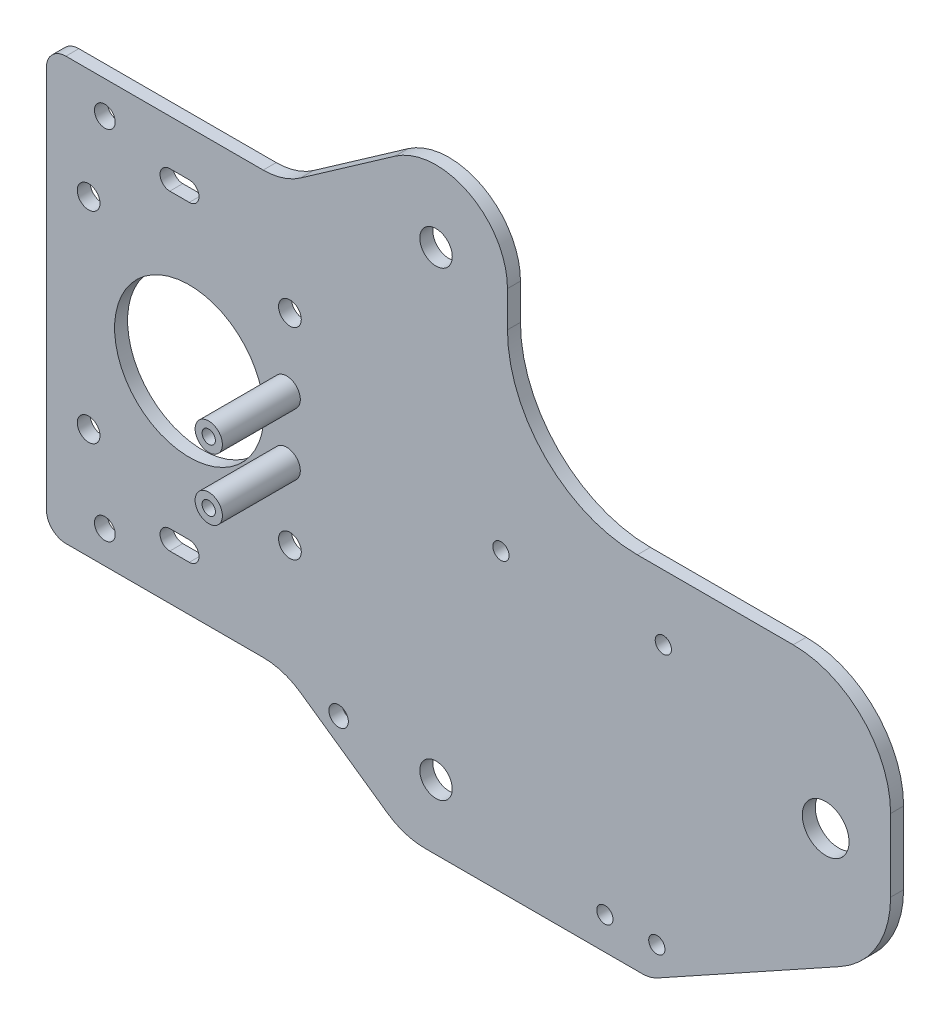
from build123d import *

# Parameters (mm, degrees)
SKETCH_1_R               = 11.5
SKETCH_1_R_2             = 1.75
SKETCH_1_R_3             = 2.5
SKETCH_1_R_4             = 3.6
SM_BASE_FLANGE_1_DEPTH   = 2
SKETCH_4_R               = 3.25
EXTRUDE_1_DEPTH          = 2
HOLE_WIZARD_M3_2_D       = 2.5
CUT_EXTRUDE_1_REACH      = 86.132
SKETCH_8_R               = 2.1
EXTRUDE_2_DEPTH          = 12
HOLE_WIZARD_M2_5_1_D     = 2.05
HOLE_WIZARD_M2_5_1_DEPTH = 10
CUT_EXTRUDE_2_REACH      = 86.89
SKETCH_11_R              = 1.6
SKETCH_12_R              = 3.25
EXTRUDE_3_DEPTH          = 2
HOLE_WIZARD_M3_3_D       = 2.5
CUT_EXTRUDE_3_REACH      = 87.195
SKETCH_15_R              = 1.5


# Sheet-metal steps are written as plain solids
with BuildPart() as part:
    # Sketch 1 → 基体-法兰1 (new body)
    with BuildSketch(Plane.XY):
        with BuildLine():
            Line((-1.743446796, -45.5), (31.707432394, -45.5))
            ThreePointArc((31.707432394, -45.5), (32.958860234, -45.340860292), (34.130627329, -44.873571345))
            Line((34.130627329, -44.873571345), (62.269584803, -29.283067879))
            ThreePointArc((62.269584803, -29.283067879), (67.923694751, -23.776689927), (70, -16.162353844))
            Line((70, -16.162353844), (70, -5))
            ThreePointArc((70, -5), (65.606601718, 5.606601718), (55, 10))
            Line((55, 10), (31, 10))
            ThreePointArc((31, 10), (16.857864376, 15.857864376), (11, 30))
            Line((11, 30), (11, 35.5))
            ThreePointArc((11, 35.5), (5.079234746, 45.257119165), (-6.3093408, 44.510672487))
            Line((-6.3093408, 44.510672487), (-20.879582297, 34.308479557))
            ThreePointArc((-20.879582297, 34.308479557), (-23.608288666, 32.962830493), (-26.615346661, 32.5))
            Line((-26.615346661, 32.5), (-57, 32.5))
            ThreePointArc((-57, 32.5), (-59.121320344, 31.621320344), (-60, 29.5))
            Line((-60, 29.5), (-60, -29.5))
            ThreePointArc((-60, -29.5), (-59.121320344, -31.621320344), (-57, -32.5))
            Line((-57, -32.5), (-26.615346661, -32.5))
            ThreePointArc((-26.615346661, -32.5), (-23.608288666, -32.962830493), (-20.879582297, -34.308479557))
            Line((-20.879582297, -34.308479557), (-7.479211159, -43.691520443))
            ThreePointArc((-7.479211159, -43.691520443), (-4.750504791, -45.037169507), (-1.743446796, -45.5))
        make_face()
        with Locations((-38, 0)):
            Circle(SKETCH_1_R, mode=Mode.SUBTRACT)
        with Locations((-22.5, 15.5)):
            Circle(SKETCH_1_R_2, mode=Mode.SUBTRACT)
        with Locations(Location((-22.5, -15.5, 0), (0, 0, 180))):
            Circle(SKETCH_1_R_2, mode=Mode.SUBTRACT)
        with Locations((0, 35.5)):
            Circle(SKETCH_1_R_3, mode=Mode.SUBTRACT)
        with Locations(Location((0, -35.5, 0), (0, 0, 180))):
            Circle(SKETCH_1_R_3, mode=Mode.SUBTRACT)
        with Locations((-53.5, -15.5)):
            Circle(SKETCH_1_R_2, mode=Mode.SUBTRACT)
        with Locations(Location((-53.5, 15.5, 0), (0, 0, 180))):
            Circle(SKETCH_1_R_2, mode=Mode.SUBTRACT)
        with Locations((60, -12)):
            Circle(SKETCH_1_R_4, mode=Mode.SUBTRACT)
    extrude(amount=-SM_BASE_FLANGE_1_DEPTH)

    # 草图4 → 凸台-拉伸1 (add)
    with BuildSketch(Plane(origin=(0, 0, -2), x_dir=(-1, 0, 0), z_dir=(0, 0, -1))):
        with Locations((-10, 0)):
            Circle(SKETCH_4_R)
        with Locations((-35, 0)):
            Circle(SKETCH_4_R)
    extrude(amount=EXTRUDE_1_DEPTH)

    # M3 螺纹孔2 (through all)
    with Locations(Plane(origin=(0, 0, 0), x_dir=(-1, 0, 0), z_dir=(0, 0, 1))):
        with Locations((-10, 0), (-35, 0)):
            Hole(HOLE_WIZARD_M3_2_D / 2)

    # 草图7 → 切除-拉伸1 (cut, up to next)
    with BuildSketch(Plane.XY, mode=Mode.PRIVATE) as cut_extrude_1_sk1:
        with BuildLine():
            Line((-38, 22.5), (-41, 22.5))
            ThreePointArc((-41, 22.5), (-42.5, 24), (-41, 25.5))
            Line((-41, 25.5), (-38, 25.5))
            ThreePointArc((-38, 25.5), (-36.5, 24), (-38, 22.5))
        make_face()
    cut_extrude_1_tool1 = extrude(cut_extrude_1_sk1.sketch, amount=-CUT_EXTRUDE_1_REACH, mode=Mode.PRIVATE) & part.part
    # 草图7 → 切除-拉伸1 (cut, up to next)
    with BuildSketch(Plane.XY, mode=Mode.PRIVATE) as cut_extrude_1_sk2:
        with BuildLine():
            Line((-38, -25.5), (-41, -25.5))
            ThreePointArc((-41, -25.5), (-42.5, -24), (-41, -22.5))
            Line((-41, -22.5), (-38, -22.5))
            ThreePointArc((-38, -22.5), (-36.5, -24), (-38, -25.5))
        make_face()
    cut_extrude_1_tool2 = extrude(cut_extrude_1_sk2.sketch, amount=-CUT_EXTRUDE_1_REACH, mode=Mode.PRIVATE) & part.part
    add(cut_extrude_1_tool1.solids().sort_by_distance((-39.5, 24, 0))[0], mode=Mode.SUBTRACT)
    add(cut_extrude_1_tool2.solids().sort_by_distance((-39.5, -24, 0))[0], mode=Mode.SUBTRACT)

    # 草图8 → 凸台-拉伸2 (add)
    with BuildSketch(Plane.XY):
        with Locations(Location((-23, 4.75, 0), (0, 0, 180))):
            Circle(SKETCH_8_R)
        with Locations(Location((-23, -4.75, 0), (0, 0, 180))):
            Circle(SKETCH_8_R)
    extrude(amount=EXTRUDE_2_DEPTH)

    # M2.5 螺纹孔1
    with Locations(Plane.XY.offset(12)):
        with Locations((-23, 4.75), (-23, -4.75)):
            Hole(HOLE_WIZARD_M2_5_1_D / 2, depth=HOLE_WIZARD_M2_5_1_DEPTH)

    # 草图11 → 切除-拉伸2 (cut, up to next)
    with BuildSketch(Plane.XY, mode=Mode.PRIVATE) as cut_extrude_2_sk1:
        with Locations((-51, 27.5)):
            Circle(SKETCH_11_R)
    cut_extrude_2_tool1 = extrude(cut_extrude_2_sk1.sketch, amount=-CUT_EXTRUDE_2_REACH, mode=Mode.PRIVATE) & part.part
    # 草图11 → 切除-拉伸2 (cut, up to next)
    with BuildSketch(Plane.XY, mode=Mode.PRIVATE) as cut_extrude_2_sk2:
        with Locations((-51, -27.5)):
            Circle(SKETCH_11_R)
    cut_extrude_2_tool2 = extrude(cut_extrude_2_sk2.sketch, amount=-CUT_EXTRUDE_2_REACH, mode=Mode.PRIVATE) & part.part
    add(cut_extrude_2_tool1.solids().sort_by_distance((-51, 27.5, 0))[0], mode=Mode.SUBTRACT)
    add(cut_extrude_2_tool2.solids().sort_by_distance((-51, -27.5, 0))[0], mode=Mode.SUBTRACT)

    # 草图12 → 凸台-拉伸3 (add)
    with BuildSketch(Plane.XY.offset(-2)):
        with Locations((26, -40.5)):
            Circle(SKETCH_12_R)
        with Locations((34, -40.5)):
            Circle(SKETCH_12_R)
    extrude(amount=-EXTRUDE_3_DEPTH)

    # M3 螺纹孔3 (through all)
    with Locations(Plane(origin=(0, 0, 0), x_dir=(-1, 0, 0), z_dir=(0, 0, 1))):
        with Locations((-34, 40.5), (-26, 40.5)):
            Hole(HOLE_WIZARD_M3_3_D / 2)

    # 草图15 → 切除-拉伸3 (cut, up to next)
    with BuildSketch(Plane(origin=(0, 0, -2), x_dir=(-1, 0, 0), z_dir=(0, 0, -1)), mode=Mode.PRIVATE) as cut_extrude_3_sk1:
        with Locations((15, -34.5)):
            Circle(SKETCH_15_R)
    cut_extrude_3_tool1 = extrude(cut_extrude_3_sk1.sketch, amount=-CUT_EXTRUDE_3_REACH, mode=Mode.PRIVATE) & part.part
    add(cut_extrude_3_tool1.solids().sort_by_distance((-15, -34.5, -2))[0], mode=Mode.SUBTRACT)


solid = part.part
